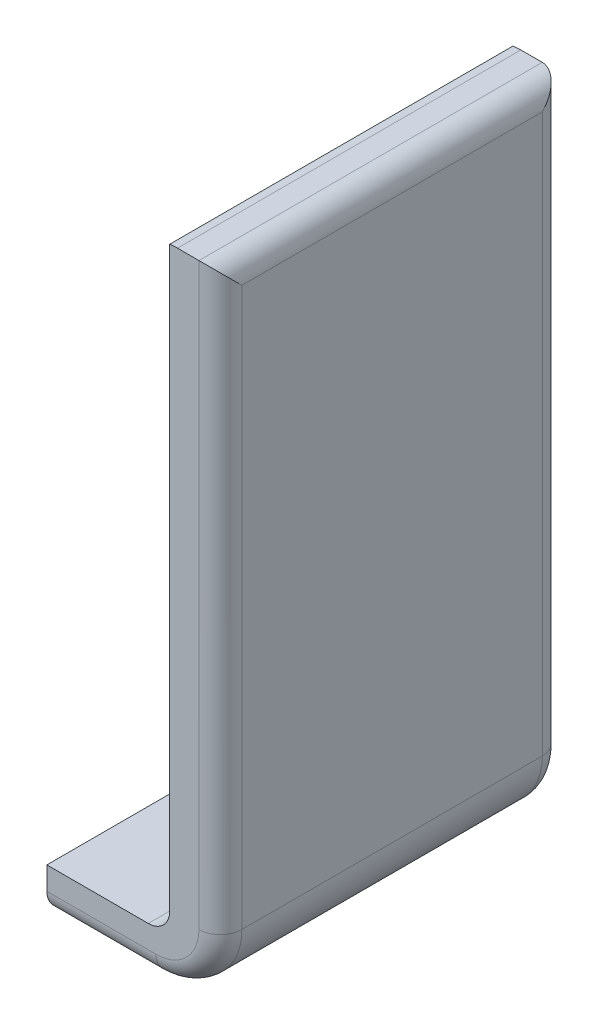
from build123d import *

# Parameters (mm, degrees)
BOSS_EXTRUDE1_DEPTH = 16
FILLET1_R           = 1
FILLET2_R           = 3
FILLET3_R           = 3
FILLET4_R           = 3
SKETCH2_W           = 7.425804379
SKETCH2_H           = 16
CUT_EXTRUDE1_DEPTH  = 13
FILLET5_R           = 3
SKETCH3_W           = 17.675238391
SKETCH3_H           = 28.7828695
CUT_EXTRUDE2_DEPTH  = 33
FILLET6_R           = 1
SKETCH4_W           = 6.794443954
SKETCH4_H           = 18.076730961
CUT_EXTRUDE3_DEPTH  = 33


with BuildPart() as part:
    # Sketch1 → Boss-Extrude1 (new body)
    with BuildSketch(Plane.XY):
        Polygon((0, 0), (21.560913706, 0), (21.560913706, 30), (16.560913706, 30), (16.560913706, 5), (0, 5), align=None)
    extrude(amount=BOSS_EXTRUDE1_DEPTH)

    # Fillet1
    fillet1_edges = [part.edges().sort_by_distance(p)[0] for p in [
        (21.560913706, 30, 8),
        (0, 0, 8),
        (21.560913706, 15, 16),
        (21.560913706, 15, 0),
        (10.780456853, 0, 0),
        (10.780456853, 0, 16),
    ]]
    fillet(fillet1_edges, radius=FILLET1_R)

    # Fillet2
    # the kernel refuses this fillet: 3 mm, written as the material it takes off along each edge
    with BuildSketch(Plane(origin=(18.560913706, 3, 16), x_dir=(0, -1, 0), z_dir=(-1, 0, 0))) as fillet2_piece_1:
        with BuildLine():
            CenterArc((2, -1), 1, 0, 90)
            Line((3, -1), (3, 0))
            Line((3, 0), (2, 0))
        make_face()
    revolve(axis=Axis((18.560913706, 3, 16), (0, 0, 1)), revolution_arc=90, mode=Mode.SUBTRACT)
    with BuildSketch(Plane(origin=(18.560913706, 3, 0), x_dir=(1, 0, 0), z_dir=(0, 1, 0))) as fillet2_piece_2:
        with BuildLine():
            CenterArc((2, -1), 1, 0, 90)
            Line((3, -1), (3, 0))
            Line((3, 0), (2, 0))
        make_face()
    revolve(axis=Axis((18.560913706, 3, 0), (0, 0, -1)), revolution_arc=90, mode=Mode.SUBTRACT)
    with BuildSketch(Plane(origin=(21.560913706, 0, 0), x_dir=(-1, 0, 0), z_dir=(0, 0, 1))) as fillet2_piece_3:
        with BuildLine():
            CenterArc((FILLET2_R, -FILLET2_R), FILLET2_R, 90, 90)
            Line((0, -FILLET2_R), (0, 0))
            Line((0, 0), (FILLET2_R, 0))
        make_face()
    extrude(amount=16, mode=Mode.SUBTRACT)

    # Fillet3
    fillet3_edges = [part.edges().sort_by_distance(p)[0] for p in [
        (16.560913706, 5, 8),
    ]]
    fillet(fillet3_edges, radius=FILLET3_R)

    # Fillet4
    fillet4_edges = [part.edges().sort_by_distance(p)[0] for p in [
        (0, 5, 8),
        (16.560913706, 30, 8),
    ]]
    fillet(fillet4_edges, radius=FILLET4_R)

    # Sketch2 → Cut-Extrude1 (cut)
    with BuildSketch(Plane.XZ):
        with Locations((3.71290219, 8)):
            Rectangle(SKETCH2_W, SKETCH2_H)
    extrude(amount=-CUT_EXTRUDE1_DEPTH, mode=Mode.SUBTRACT)

    # Fillet5
    fillet5_edges = [part.edges().sort_by_distance(p)[0] for p in [
        (7.425804379, 5, 8),
    ]]
    fillet(fillet5_edges, radius=FILLET5_R)

    # Sketch3 → Cut-Extrude2 (cut)
    with BuildSketch(Plane(origin=(0, 0, 0), x_dir=(-1, 0, 0), z_dir=(0, 0, -1))):
        with Locations((-10.361055803, 16.45457074)):
            Rectangle(SKETCH3_W, SKETCH3_H)
    extrude(amount=-CUT_EXTRUDE2_DEPTH, mode=Mode.SUBTRACT)

    # Fillet6
    fillet6_edges = [part.edges().sort_by_distance(p)[0] for p in [
        (19.198674998, 2.06313599, 8),
    ]]
    fillet(fillet6_edges, radius=FILLET6_R)

    # Sketch4 → Cut-Extrude3 (cut)
    with BuildSketch(Plane(origin=(0, 2.06313599, 0), x_dir=(1, 0, 0), z_dir=(0, 1, 0))):
        with Locations((10.074463298, -8.207535366)):
            Rectangle(SKETCH4_W, SKETCH4_H)
    extrude(amount=-CUT_EXTRUDE3_DEPTH, mode=Mode.SUBTRACT)


solid = part.part
